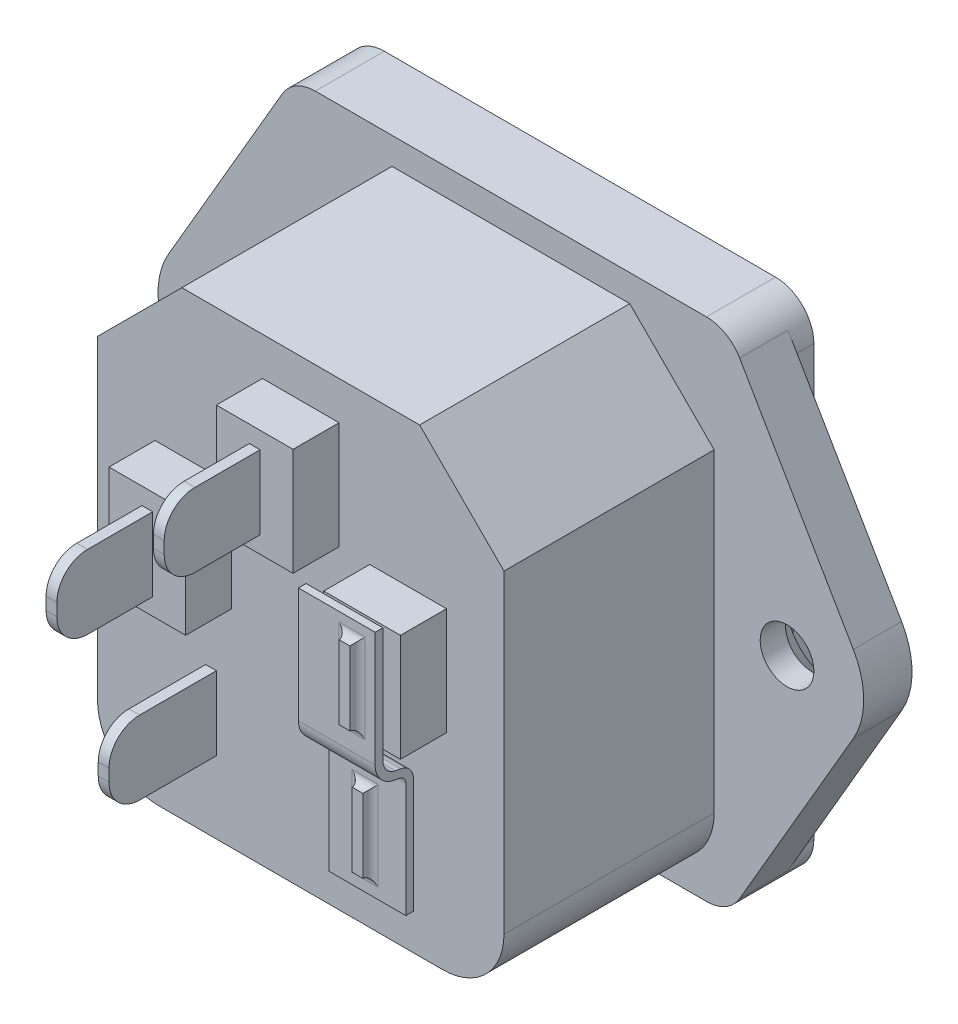
from build123d import *

# Parameters (mm, degrees)
SKETCH1_R           = 1.75
EXTRUDE1_DEPTH      = 3.15
CHAMFER1_SIZE       = 1.5
EXTRUDE2_START      = 1.35
EXTRUDE2_DEPTH      = 1.35
EXTRUDE3_DEPTH      = 13.7
SKETCH4_W           = 5
SKETCH4_H           = 7
EXTRUDE4_DEPTH      = 3
SKETCH5_W           = 0.7
SKETCH5_H           = 4.8
EXTRUDE5_DEPTH      = 6.25
EXTRUDE6_DEPTH      = 17
FILLET1_R           = 0.5
SKETCH7_W           = 2
SKETCH7_H           = 4
EXTRUDE7_DEPTH      = 14
SKETCH8_W           = 2
SKETCH8_H           = 4
EXTRUDE8_DEPTH      = 16.5
CHAMFER3_SIZE       = 0.75
SKETCH9_W           = 0.7
SKETCH9_H           = 4.8
EXTRUDE9_DEPTH      = 7
FILLET2_R           = 2
EXTRUDE_THIN1_DEPTH = 2.5
EXTRUDE10_DEPTH     = 2
FILLET3_R           = 0.5
FILLET4_R           = 0.5
SKETCH13_W          = 24.5
SKETCH13_H          = 8.5
EXTRUDE11_DEPTH     = 0.5


with BuildPart() as part:
    # Sketch1 → Extrude1 (new body)
    with BuildSketch(Plane.XY):
        with BuildLine():
            Line((-12.75, 11.25), (12.75, 11.25))
            ThreePointArc((12.75, 11.25), (13.996574867, 10.917037402), (14.911099489, 10.00684088))
            Line((14.911099489, 10.00684088), (22.322198979, -2.73631824))
            ThreePointArc((22.322198979, -2.73631824), (23, -5.25), (22.322198979, -7.76368176))
            Line((22.322198979, -7.76368176), (14.911099489, -20.50684088))
            ThreePointArc((14.911099489, -20.50684088), (13.996574867, -21.417037402), (12.75, -21.75))
            Line((12.75, -21.75), (-12.75, -21.75))
            ThreePointArc((-12.75, -21.75), (-13.996574867, -21.417037402), (-14.911099489, -20.50684088))
            Line((-14.911099489, -20.50684088), (-22.322198979, -7.76368176))
            ThreePointArc((-22.322198979, -7.76368176), (-23, -5.25), (-22.322198979, -2.73631824))
            Line((-22.322198979, -2.73631824), (-14.911099489, 10.00684088))
            ThreePointArc((-14.911099489, 10.00684088), (-13.996574867, 10.917037402), (-12.75, 11.25))
        make_face()
        with Locations((-18, -5.25)):
            Circle(SKETCH1_R, mode=Mode.SUBTRACT)
        with Locations((18, -5.25)):
            Circle(SKETCH1_R, mode=Mode.SUBTRACT)
    extrude(amount=EXTRUDE1_DEPTH)

    # Chamfer1
    chamfer1_edges = [part.edges().sort_by_distance(p)[0] for p in [
        (-19.75, -5.25, 0),
        (16.25, -5.25, 0),
    ]]
    chamfer(chamfer1_edges, length=CHAMFER1_SIZE)

    # Sketch2 → Extrude2 (add)
    with BuildSketch(Plane(origin=(0, 0, 0), x_dir=(-1, 0, 0), z_dir=(0, 0, -1)).offset(EXTRUDE2_START)):
        with BuildLine():
            Line((-12.75, 11.25), (12.75, 11.25))
            ThreePointArc((12.75, 11.25), (14.517766953, 10.517766953), (15.25, 8.75))
            Line((15.25, 8.75), (15.25, -19.25))
            ThreePointArc((15.25, -19.25), (14.517766953, -21.017766953), (12.75, -21.75))
            Line((12.75, -21.75), (-12.75, -21.75))
            ThreePointArc((-12.75, -21.75), (-14.517766953, -21.017766953), (-15.25, -19.25))
            Line((-15.25, -19.25), (-15.25, 8.75))
            ThreePointArc((-15.25, 8.75), (-14.517766953, 10.517766953), (-12.75, 11.25))
        make_face()
    extrude(amount=-EXTRUDE2_DEPTH)

    # Sketch3 → Extrude3 (add)
    with BuildSketch(Plane.XY.offset(3.15)):
        with BuildLine():
            Line((-7.75, 9.5), (7.75, 9.5))
            Line((7.75, 9.5), (13.25, 4))
            Line((13.25, 4), (13.25, -16.5))
            ThreePointArc((13.25, -16.5), (12.078427125, -19.328427125), (9.25, -20.5))
            Line((9.25, -20.5), (-9.25, -20.5))
            ThreePointArc((-9.25, -20.5), (-12.078427125, -19.328427125), (-13.25, -16.5))
            Line((-13.25, -16.5), (-13.25, 4))
            Line((-13.25, 4), (-7.75, 9.5))
        make_face()
    extrude(amount=EXTRUDE3_DEPTH)

    # Sketch4 → Extrude4 (add)
    with BuildSketch(Plane.XY.offset(16.85)):
        with Locations((-7, -3.5)):
            Rectangle(SKETCH4_W, SKETCH4_H)
        with Locations((0, 3.5)):
            Rectangle(SKETCH4_W, SKETCH4_H)
        with Locations((7, -3.5)):
            Rectangle(SKETCH4_W, SKETCH4_H)
    extrude(amount=EXTRUDE4_DEPTH)

    # Sketch5 → Extrude5 (add)
    with BuildSketch(Plane.XY.offset(19.85)):
        with Locations((0, 3.5)):
            Rectangle(SKETCH5_W, SKETCH5_H)
        with Locations((7, -3.5)):
            Rectangle(SKETCH5_W, SKETCH5_H)
        with Locations((-7, -3.5)):
            Rectangle(SKETCH5_W, SKETCH5_H)
    extrude(amount=EXTRUDE5_DEPTH)

    # Sketch6 → Extrude6 (cut)
    with BuildSketch(Plane(origin=(0, 0, -1.35), x_dir=(-1, 0, 0), z_dir=(0, 0, -1))):
        with BuildLine():
            Line((-6.7, 7.85), (6.7, 7.85))
            Line((6.7, 7.85), (12.2, 2.35))
            Line((12.2, 2.35), (12.2, -5.35))
            ThreePointArc((12.2, -5.35), (11.467766953, -7.117766953), (9.7, -7.85))
            Line((9.7, -7.85), (-9.7, -7.85))
            ThreePointArc((-9.7, -7.85), (-11.467766953, -7.117766953), (-12.2, -5.35))
            Line((-12.2, -5.35), (-12.2, 2.35))
            Line((-12.2, 2.35), (-6.7, 7.85))
        make_face()
    extrude(amount=-EXTRUDE6_DEPTH, mode=Mode.SUBTRACT)

    # Fillet1
    fillet1_edges = [part.edges().sort_by_distance(p)[0] for p in [
        (9.45, 5.1, -1.35),
        (12.2, -1.5, -1.35),
        (11.467766953, -7.117766953, -1.35),
        (0, -7.85, -1.35),
        (-11.467766953, -7.117766953, -1.35),
        (-12.2, -1.5, -1.35),
        (-9.45, 5.1, -1.35),
        (0, 7.85, -1.35),
    ]]
    fillet(fillet1_edges, radius=FILLET1_R)

    # Sketch7 → Extrude7 (add)
    with BuildSketch(Plane(origin=(0, 0, 15.65), x_dir=(-1, 0, 0), z_dir=(0, 0, -1))):
        with Locations((-7, -2)):
            Rectangle(SKETCH7_W, SKETCH7_H)
        with Locations((7, -2)):
            Rectangle(SKETCH7_W, SKETCH7_H)
    extrude(amount=EXTRUDE7_DEPTH)

    # Sketch8 → Extrude8 (add)
    with BuildSketch(Plane(origin=(0, 0, 15.65), x_dir=(-1, 0, 0), z_dir=(0, 0, -1))):
        with Locations((0, 2)):
            Rectangle(SKETCH8_W, SKETCH8_H)
    extrude(amount=EXTRUDE8_DEPTH)

    # Chamfer3
    chamfer3_edges = [part.edges().sort_by_distance(p)[0] for p in [
        (8, -2, 1.65),
        (7, -4, 1.65),
        (6, -2, 1.65),
        (7, 0, 1.65),
        (-6, -2, 1.65),
        (-7, -4, 1.65),
        (-8, -2, 1.65),
        (-7, 0, 1.65),
        (1, 2, -0.85),
        (0, 0, -0.85),
        (-1, 2, -0.85),
        (0, 4, -0.85),
    ]]
    chamfer(chamfer3_edges, length=CHAMFER3_SIZE)

    # Sketch9 → Extrude9 (add)
    with BuildSketch(Plane.XY.offset(16.85)):
        with Locations((-5.85, -13.4)):
            Rectangle(SKETCH9_W, SKETCH9_H)
        with Locations((5.85, -13.4)):
            Rectangle(SKETCH9_W, SKETCH9_H)
    extrude(amount=EXTRUDE9_DEPTH)

    # Fillet2
    fillet2_edges = [part.edges().sort_by_distance(p)[0] for p in [
        (0, 1.1, 26.1),
        (0, 5.9, 26.1),
        (7, -5.9, 26.1),
        (7, -1.1, 26.1),
        (-7, -5.9, 26.1),
        (-7, -1.1, 26.1),
        (-5.85, -15.8, 23.85),
        (-5.85, -11, 23.85),
        (5.85, -15.8, 23.85),
        (5.85, -11, 23.85),
    ]]
    fillet(fillet2_edges, radius=FILLET2_R)

    # Sketch10 → Extrude-Thin1 (add, symmetric)
    with BuildSketch(Plane(origin=(6, 0, 0), x_dir=(0, 0, -1), z_dir=(1, 0, 0))):
        with BuildLine():
            Line((-20, 0), (-20, -7.5))
            ThreePointArc((-20, -7.5), (-19.766044443, -8.14278761), (-19.173648178, -8.484807753))
            Line((-19.173648178, -8.484807753), (-18.826351822, -8.546045471))
            ThreePointArc((-18.826351822, -8.546045471), (-18.233955557, -8.888065614), (-18, -9.530853224))
            Line((-18, -9.530853224), (-18, -17))
            Line((-18, -17), (-18.5, -17))
            Line((-18.5, -17), (-18.5, -9.530853224))
            ThreePointArc((-18.5, -9.530853224), (-18.616977778, -9.209459419), (-18.913175911, -9.038449347))
            Line((-18.913175911, -9.038449347), (-19.260472267, -8.97721163))
            ThreePointArc((-19.260472267, -8.97721163), (-20.149066665, -8.464181415), (-20.5, -7.5))
            Line((-20.5, -7.5), (-20.5, 0))
            Line((-20.5, 0), (-20, 0))
        make_face()
    extrude(amount=EXTRUDE_THIN1_DEPTH, both=True)

    # Sketch12 → Extrude10 (cut)
    with BuildSketch(Plane(origin=(7.35, 0, 0), x_dir=(0, 0, -1), z_dir=(1, 0, 0))):
        Polygon((-21, -1.1), (-21, -10.028067218), (-19, -10.028067218), (-19, -16.1), (-27, -16.1), (-27, -1.1), align=None)
    extrude(amount=-EXTRUDE10_DEPTH, mode=Mode.SUBTRACT)

    # Fillet3
    fillet3_edges = [part.edges().sort_by_distance(p)[0] for p in [
        (5.85, -11, 18.5),
        (5.5, -13.4, 18.5),
        (5.85, -15.8, 18.5),
        (6.2, -13.4, 18.5),
    ]]
    fillet(fillet3_edges, radius=FILLET3_R - 0.0001)  # a hair under: the kernel refuses the full size

    # Fillet4
    fillet4_edges = [part.edges().sort_by_distance(p)[0] for p in [
        (7, -1.1, 20.5),
        (6.65, -3.5, 20.5),
        (7, -5.9, 20.5),
        (7.35, -3.5, 20.5),
    ]]
    fillet(fillet4_edges, radius=FILLET4_R - 0.0001)  # a hair under: the kernel refuses the full size

    # Sketch13 → Extrude11 (add)
    with BuildSketch(Plane(origin=(0, 0, -1.35), x_dir=(-1, 0, 0), z_dir=(0, 0, -1))):
        with Locations((0, -14.25)):
            Rectangle(SKETCH13_W, SKETCH13_H)
    extrude(amount=EXTRUDE11_DEPTH)


solid = part.part
